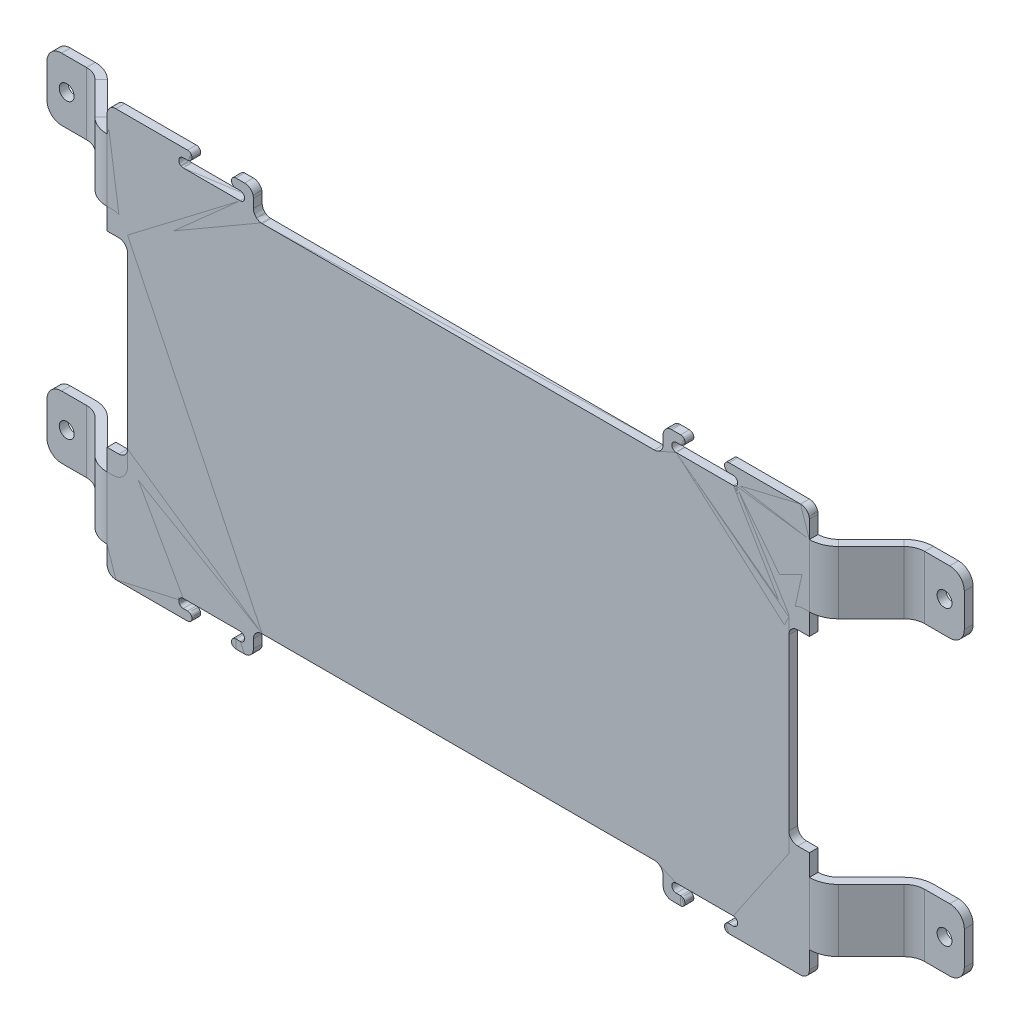
from build123d import *

# Parameters (mm, degrees)
SKETCH1_W               = 300
SKETCH1_H               = 121.403047612
BOSS_EXTRUDE1_DEPTH     = 3
SKETCH2_W               = 51.145988648
SKETCH2_H               = 64
CUT_EXTRUDE1_DEPTH      = 3
SKETCH3_W               = 50
SKETCH3_H               = 9
BOSS_EXTRUDE2_DEPTH     = 3
MIRROR4_COPY_1_SKETCH_W = 50
MIRROR4_COPY_1_SKETCH_H = 9
MIRROR4_COPY_1_DEPTH    = 3
FILLET2_R               = 3
FILLET3_R               = 3
SKETCH4_R               = 2.55
CUT_EXTRUDE2_DEPTH      = 3
SKETCH5_W               = 13.5
SKETCH5_H               = 3
CUT_EXTRUDE3_DEPTH      = 3
MIRROR6_COPY_1_SKETCH_W = 13.5
MIRROR6_COPY_1_SKETCH_H = 3
MIRROR6_COPY_1_DEPTH    = 3
FILLET4_R               = 1.5
SKETCH23_W              = 33.720108899
SKETCH23_H              = 36.264957758
SKETCH23_W_2            = 33.5
SKETCH23_H_2            = 38.701523806
SKETCH23_W_3            = 34.098271517
SKETCH23_H_3            = 33.701523806
SKETCH23_W_4            = 35
SKETCH23_H_4            = 37.201523806
CUT_EXTRUDE5_DEPTH      = 3
CONVERT_SOLID1_DEPTH    = 3
EDGE_FLANGE5_DEPTH      = 28.701523806
EDGE_FLANGE6_DEPTH      = 28.701523806
SKETCH34_R              = 2.55
CUT_EXTRUDE6_DEPTH      = 3
CUT_EXTRUDE7_START      = -3
SKETCH35_W              = 46.091883092
SKETCH35_H              = 10.3
CUT_EXTRUDE7_DEPTH      = 19.192388
SKETCH36_W              = 2.331883092
SKETCH36_H              = 21.401523806
CUT_EXTRUDE8_DEPTH      = 3
MIRROR8_COPY_1_DEPTH    = 28.701523806
MIRROR8_COPY_2_DEPTH    = 28.701523806
MIRROR8_COPY_3_SKETCH_R = 2.55
MIRROR8_COPY_3_DEPTH    = 3
MIRROR8_START           = -3
MIRROR8_COPY_4_SKETCH_W = 46.091883092
MIRROR8_COPY_4_SKETCH_H = 10.3
MIRROR8_COPY_4_DEPTH    = 19.192388
MIRROR8_COPY_5_SKETCH_W = 2.331883092
MIRROR8_COPY_5_SKETCH_H = 21.401523806
MIRROR8_COPY_5_DEPTH    = 3
FILLET5_R               = 5
FILLET6_R               = 5


# Read off the part's stored shape, not the designer's step: Convert-Solid1
# Sheet-metal steps are written as plain solids
with BuildPart() as part:
    # Sketch1 → Boss-Extrude1 (new body)
    with BuildSketch(Plane.XY):
        Rectangle(SKETCH1_W, SKETCH1_H)
    extrude(amount=BOSS_EXTRUDE1_DEPTH)

    # Sketch2 → Cut-Extrude1 (cut)
    with BuildSketch(Plane.XY.offset(3)):
        with Locations((-138.572994324, 0)):
            Rectangle(SKETCH2_W, SKETCH2_H)
    cut_extrude1 = extrude(amount=-CUT_EXTRUDE1_DEPTH, mode=Mode.SUBTRACT)

    # Mirror1: Cut-Extrude1 across plane
    add(cut_extrude1.mirror(Plane(origin=(0, 0, 0), x_dir=(0, 0, 1), z_dir=(1, 0, 0))), mode=Mode.SUBTRACT)

    # Sketch3 → Boss-Extrude2 (add)
    with BuildSketch(Plane.XY.offset(3)):
        with Locations((-95, -65.201523806)):
            Rectangle(SKETCH3_W, SKETCH3_H)
        with BuildLine():
            Line((-94, -63.701523806), (-74.5, -63.701523806))
            ThreePointArc((-74.5, -63.701523806), (-73, -65.201523806), (-74.5, -66.701523806))
            Line((-74.5, -66.701523806), (-94, -66.701523806))
            ThreePointArc((-94, -66.701523806), (-95.5, -65.201523806), (-94, -63.701523806))
        make_face(mode=Mode.SUBTRACT)
    boss_extrude2 = extrude(amount=-BOSS_EXTRUDE2_DEPTH)

    # Mirror3: Boss-Extrude2 across plane
    add(boss_extrude2.mirror(Plane.ZX))

    # Mirror4: Boss-Extrude2 across plane
    add(boss_extrude2.mirror(Plane(origin=(0, 0, 0), x_dir=(0, 0, 1), z_dir=(1, 0, 0))))

    # Mirror4 copy 1 sketch → Mirror4 copy 1 (add)
    with BuildSketch(Plane(origin=(0, 0, 3), x_dir=(-1, 0, 0), z_dir=(0, 0, 1))):
        with Locations((-95, -65.201523806)):
            Rectangle(MIRROR4_COPY_1_SKETCH_W, MIRROR4_COPY_1_SKETCH_H)
        with BuildLine():
            Line((-94, -63.701523806), (-74.5, -63.701523806))
            ThreePointArc((-74.5, -63.701523806), (-73, -65.201523806), (-74.5, -66.701523806))
            Line((-74.5, -66.701523806), (-94, -66.701523806))
            ThreePointArc((-94, -66.701523806), (-95.5, -65.201523806), (-94, -63.701523806))
        make_face(mode=Mode.SUBTRACT)
    extrude(amount=-MIRROR4_COPY_1_DEPTH)

    # Fillet2
    fillet2_edges = [part.edges().sort_by_distance(p)[0] for p in [
        (120, -60.701523806, 1.5),
        (120, 69.701523806, 1.5),
        (120, 60.701523806, 1.5),
        (70, 60.701523806, 1.5),
        (70, 69.701523806, 1.5),
        (-120, -69.701523806, 1.5),
        (-120, -60.701523806, 1.5),
        (-70, -60.701523806, 1.5),
        (-70, -69.701523806, 1.5),
        (-70, 60.701523806, 1.5),
        (-70, 69.701523806, 1.5),
        (-120, 69.701523806, 1.5),
        (-120, 60.701523806, 1.5),
        (70, -60.701523806, 1.5),
        (70, -69.701523806, 1.5),
        (120, -69.701523806, 1.5),
    ]]
    fillet(fillet2_edges, radius=FILLET2_R)

    # Fillet3
    fillet3_edges = [part.edges().sort_by_distance(p)[0] for p in [
        (-150, 32, 1.5),
        (-150, -32, 1.5),
        (-113, -32, 1.5),
        (-113, 32, 1.5),
        (113, 32, 1.5),
        (113, -32, 1.5),
        (150, 32, 1.5),
        (150, -32, 1.5),
        (-150, -60.701523806, 1.5),
        (150, -60.701523806, 1.5),
        (150, 60.701523806, 1.5),
        (-150, 60.701523806, 1.5),
    ]]
    fillet(fillet3_edges, radius=FILLET3_R)

    # Sketch4 → Cut-Extrude2 (cut)
    with BuildSketch(Plane(origin=(0, 0, 0), x_dir=(-1, 0, 0), z_dir=(0, 0, -1))):
        with Locations((-139.660923088, -50)):
            Circle(SKETCH4_R)
        with Locations((-139.660923088, 50)):
            Circle(SKETCH4_R)
        with Locations((150, -50)):
            Circle(SKETCH4_R)
        with Locations((150, 50)):
            Circle(SKETCH4_R)
    extrude(amount=-CUT_EXTRUDE2_DEPTH, mode=Mode.SUBTRACT)

    # Sketch5 → Cut-Extrude3 (cut)
    with BuildSketch(Plane.XY.offset(3)):
        with Locations((84.25, 68.201523806)):
            Rectangle(SKETCH5_W, SKETCH5_H)
    cut_extrude3 = extrude(amount=-CUT_EXTRUDE3_DEPTH, mode=Mode.SUBTRACT)

    # Mirror5: Cut-Extrude3 across plane
    add(cut_extrude3.mirror(Plane.ZX), mode=Mode.SUBTRACT)

    # Mirror6: Cut-Extrude3 across plane
    add(cut_extrude3.mirror(Plane(origin=(0, 0, 0), x_dir=(0, 0, 1), z_dir=(1, 0, 0))), mode=Mode.SUBTRACT)

    # Mirror6 copy 1 sketch → Mirror6 copy 1 (cut)
    with BuildSketch(Plane(origin=(0, 0, 3), x_dir=(-1, 0, 0), z_dir=(0, 0, 1))):
        with Locations((84.25, 68.201523806)):
            Rectangle(MIRROR6_COPY_1_SKETCH_W, MIRROR6_COPY_1_SKETCH_H)
    extrude(amount=-MIRROR6_COPY_1_DEPTH, mode=Mode.SUBTRACT)

    # Fillet4
    fillet4_edges = [part.edges().sort_by_distance(p)[0] for p in [
        (91, 66.701523806, 1.5),
        (77.5, 66.701523806, 1.5),
        (77.5, 69.701523806, 1.5),
        (91, 69.701523806, 1.5),
        (-91, 69.701523806, 1.5),
        (-91, 66.701523806, 1.5),
        (-77.5, 66.701523806, 1.5),
        (-77.5, 69.701523806, 1.5),
        (-77.5, -69.701523806, 1.5),
        (-77.5, -66.701523806, 1.5),
        (-91, -69.701523806, 1.5),
        (-91, -66.701523806, 1.5),
        (77.5, -69.701523806, 1.5),
        (91, -69.701523806, 1.5),
        (91, -66.701523806, 1.5),
        (77.5, -66.701523806, 1.5),
    ]]
    fillet(fillet4_edges, radius=FILLET4_R - 0.0001)  # a hair under: the kernel refuses the full size

    # Sketch23 → Cut-Extrude5 (cut)
    with BuildSketch(Plane.XY.offset(3)):
        with Locations((-136.86005445, 45.569044927)):
            Rectangle(SKETCH23_W, SKETCH23_H)
        with Locations((-136.75, -44.350761903)):
            Rectangle(SKETCH23_W_2, SKETCH23_H_2)
        with Locations((137.049135759, -46.850761903)):
            Rectangle(SKETCH23_W_3, SKETCH23_H_3)
        with Locations((137.5, 45.100761903)):
            Rectangle(SKETCH23_W_4, SKETCH23_H_4)
    extrude(amount=-CUT_EXTRUDE5_DEPTH, mode=Mode.SUBTRACT)


with BuildPart() as body_2:
    # Convert-Solid1 outline → Convert-Solid1 (new body)
    with BuildSketch(Plane.XY):
        with BuildLine():
            ThreePointArc((-120, -66.701523806), (-119.121320344, -68.822844149), (-117, -69.701523806))
            Line((-117, -69.701523806), (-92.5, -69.701523806))
            ThreePointArc((-92.5, -69.701523806), (-91.439339828, -69.262183978), (-91, -68.201523806))
            ThreePointArc((-91, -68.201523806), (-91.439339828, -67.140863634), (-92.5, -66.701523806))
            Line((-92.5, -66.701523806), (-94, -66.701523806))
            ThreePointArc((-94, -66.701523806), (-95.5, -65.201523806), (-94, -63.701523806))
            Line((-94, -63.701523806), (-74.5, -63.701523806))
            ThreePointArc((-74.5, -63.701523806), (-73, -65.201523806), (-74.5, -66.701523806))
            Line((-74.5, -66.701523806), (-76, -66.701523806))
            ThreePointArc((-76, -66.701523806), (-77.060660172, -67.140863634), (-77.5, -68.201523806))
            ThreePointArc((-77.5, -68.201523806), (-77.060660172, -69.262183978), (-76, -69.701523806))
            Line((-76, -69.701523806), (-73, -69.701523806))
            ThreePointArc((-73, -69.701523806), (-70.878679656, -68.822844149), (-70, -66.701523806))
            Line((-70, -66.701523806), (-70, -63.701523806))
            ThreePointArc((-70, -63.701523806), (-69.121320344, -61.580203462), (-67, -60.701523806))
            Line((-67, -60.701523806), (67, -60.701523806))
            ThreePointArc((67, -60.701523806), (69.121320344, -61.580203462), (70, -63.701523806))
            Line((70, -63.701523806), (70, -66.701523806))
            ThreePointArc((70, -66.701523806), (70.878679656, -68.822844149), (73, -69.701523806))
            Line((73, -69.701523806), (76, -69.701523806))
            ThreePointArc((76, -69.701523806), (77.060660172, -69.262183978), (77.5, -68.201523806))
            ThreePointArc((77.5, -68.201523806), (77.060660172, -67.140863634), (76, -66.701523806))
            Line((76, -66.701523806), (74.5, -66.701523806))
            ThreePointArc((74.5, -66.701523806), (73, -65.201523806), (74.5, -63.701523806))
            Line((74.5, -63.701523806), (94, -63.701523806))
            ThreePointArc((94, -63.701523806), (95.5, -65.201523806), (94, -66.701523806))
            Line((94, -66.701523806), (92.5, -66.701523806))
            ThreePointArc((92.5, -66.701523806), (91.439339828, -67.140863634), (91, -68.201523806))
            ThreePointArc((91, -68.201523806), (91.439339828, -69.262183978), (92.5, -69.701523806))
            Line((92.5, -69.701523806), (117, -69.701523806))
            ThreePointArc((117, -69.701523806), (119.121320344, -68.822844149), (120, -66.701523806))
            Line((120, -66.701523806), (120, -32))
            Line((120, -32), (116, -32))
            ThreePointArc((116, -32), (113.878679656, -31.121320344), (113, -29))
            Line((113, -29), (113, 29))
            ThreePointArc((113, 29), (113.878679656, 31.121320344), (116, 32))
            Line((116, 32), (120, 32))
            Line((120, 32), (120, 66.701523806))
            ThreePointArc((120, 66.701523806), (119.121320344, 68.822844149), (117, 69.701523806))
            Line((117, 69.701523806), (92.5, 69.701523806))
            ThreePointArc((92.5, 69.701523806), (91.439339828, 69.262183978), (91, 68.201523806))
            ThreePointArc((91, 68.201523806), (91.439339828, 67.140863634), (92.5, 66.701523806))
            Line((92.5, 66.701523806), (94, 66.701523806))
            ThreePointArc((94, 66.701523806), (95.5, 65.201523806), (94, 63.701523806))
            Line((94, 63.701523806), (74.5, 63.701523806))
            ThreePointArc((74.5, 63.701523806), (73, 65.201523806), (74.5, 66.701523806))
            Line((74.5, 66.701523806), (76, 66.701523806))
            ThreePointArc((76, 66.701523806), (77.060660172, 67.140863634), (77.5, 68.201523806))
            ThreePointArc((77.5, 68.201523806), (77.060660172, 69.262183978), (76, 69.701523806))
            Line((76, 69.701523806), (73, 69.701523806))
            ThreePointArc((73, 69.701523806), (70.878679656, 68.822844149), (70, 66.701523806))
            Line((70, 66.701523806), (70, 63.701523806))
            ThreePointArc((70, 63.701523806), (69.121320344, 61.580203462), (67, 60.701523806))
            Line((67, 60.701523806), (-67, 60.701523806))
            ThreePointArc((-67, 60.701523806), (-69.121320344, 61.580203462), (-70, 63.701523806))
            Line((-70, 63.701523806), (-70, 66.701523806))
            ThreePointArc((-70, 66.701523806), (-70.878679656, 68.822844149), (-73, 69.701523806))
            Line((-73, 69.701523806), (-76, 69.701523806))
            ThreePointArc((-76, 69.701523806), (-77.060660172, 69.262183978), (-77.5, 68.201523806))
            ThreePointArc((-77.5, 68.201523806), (-77.060660172, 67.140863634), (-76, 66.701523806))
            Line((-76, 66.701523806), (-74.5, 66.701523806))
            ThreePointArc((-74.5, 66.701523806), (-73, 65.201523806), (-74.5, 63.701523806))
            Line((-74.5, 63.701523806), (-94, 63.701523806))
            ThreePointArc((-94, 63.701523806), (-95.5, 65.201523806), (-94, 66.701523806))
            Line((-94, 66.701523806), (-92.5, 66.701523806))
            ThreePointArc((-92.5, 66.701523806), (-91.439339828, 67.140863634), (-91, 68.201523806))
            ThreePointArc((-91, 68.201523806), (-91.439339828, 69.262183978), (-92.5, 69.701523806))
            Line((-92.5, 69.701523806), (-117, 69.701523806))
            ThreePointArc((-117, 69.701523806), (-119.121320344, 68.822844149), (-120, 66.701523806))
            Line((-120, 66.701523806), (-120, 32))
            Line((-120, 32), (-116, 32))
            ThreePointArc((-116, 32), (-113.878679656, 31.121320344), (-113, 29))
            Line((-113, 29), (-113, -29))
            ThreePointArc((-113, -29), (-113.878679656, -31.121320344), (-116, -32))
            Line((-116, -32), (-120, -32))
            Line((-120, -32), (-120, -66.701523806))
        make_face()
    extrude(amount=CONVERT_SOLID1_DEPTH)

    # Edge-Flange5 section (across the edge) → Edge-Flange5 (add)
    with BuildSketch(Plane(origin=(122.899494937, -32, 0), x_dir=(-0.7071067811865438, 0, -0.7071067811865512), z_dir=(0, -1, 0))):
        with BuildLine():
            Line((-3, 2.899494937), (-3, 18.757359313))
            Line((-3, 18.757359313), (0, 18.757359313))
            Line((0, 18.757359313), (0, 2.899494937))
            ThreePointArc((0, 2.899494937), (0.532843272, 0.22071091), (2.050252532, -2.050252532))
            Line((2.050252532, -2.050252532), (-0.071067812, -4.171572875))
            ThreePointArc((-0.071067812, -4.171572875), (-2.238795325, -0.927339387), (-3, 2.899494937))
        make_face()
    edge_flange5 = extrude(amount=EDGE_FLANGE5_DEPTH)

    # Edge-Flange6 section (across the edge) → Edge-Flange6 (add)
    with BuildSketch(Plane(origin=(140.334523779, -60.701523806, -13.192388155), x_dir=(0, 0, 1), z_dir=(0, 1, 0))):
        with BuildLine():
            Line((-3, 2.899494937), (-3, 18.757359313))
            Line((-3, 18.757359313), (0, 18.757359313))
            Line((0, 18.757359313), (0, 2.899494937))
            ThreePointArc((0, 2.899494937), (0.532843272, 0.22071091), (2.050252532, -2.050252532))
            Line((2.050252532, -2.050252532), (-0.071067812, -4.171572875))
            ThreePointArc((-0.071067812, -4.171572875), (-2.238795325, -0.927339387), (-3, 2.899494937))
        make_face()
    edge_flange6 = extrude(amount=EDGE_FLANGE6_DEPTH)

    # Sketch34 → Cut-Extrude6 (cut)
    with BuildSketch(Plane.XY.offset(-13.192388155)):
        with Locations((150, -50)):
            Circle(SKETCH34_R)
    cut_extrude6 = extrude(amount=-CUT_EXTRUDE6_DEPTH, mode=Mode.SUBTRACT)

    # Sketch35 → Cut-Extrude7 (cut)
    with BuildSketch(Plane.XY.offset(-13.192388155).offset(CUT_EXTRUDE7_START)):
        with Locations((136.045941546, -34.15)):
            Rectangle(SKETCH35_W, SKETCH35_H)
    cut_extrude7 = extrude(amount=CUT_EXTRUDE7_DEPTH, mode=Mode.SUBTRACT)

    # Sketch36 → Cut-Extrude8 (cut)
    with BuildSketch(Plane.XY.offset(-13.192388155)):
        with Locations((157.925941546, -50.000761903)):
            Rectangle(SKETCH36_W, SKETCH36_H)
    cut_extrude8 = extrude(amount=-CUT_EXTRUDE8_DEPTH, mode=Mode.SUBTRACT)

    # Mirror7: Edge-Flange5, Edge-Flange6 across plane
    add(edge_flange5.mirror(Plane.ZX))
    add(edge_flange6.mirror(Plane.ZX))

    # Mirror7 2: Cut-Extrude6, Cut-Extrude7, Cut-Extrude8 across plane
    add(cut_extrude6.mirror(Plane.ZX), mode=Mode.SUBTRACT)
    add(cut_extrude7.mirror(Plane.ZX), mode=Mode.SUBTRACT)
    add(cut_extrude8.mirror(Plane.ZX), mode=Mode.SUBTRACT)

    # Mirror8: Edge-Flange5, Edge-Flange6, Cut-Extrude6, Cut-Extrude7, Cut-Extrude8 across plane
    add(edge_flange5.mirror(Plane(origin=(0, 0, 0), x_dir=(0, 0, 1), z_dir=(1, 0, 0))))
    add(edge_flange6.mirror(Plane(origin=(0, 0, 0), x_dir=(0, 0, 1), z_dir=(1, 0, 0))))
    add(cut_extrude6.mirror(Plane(origin=(0, 0, 0), x_dir=(0, 0, 1), z_dir=(1, 0, 0))), mode=Mode.SUBTRACT)
    add(cut_extrude7.mirror(Plane(origin=(0, 0, 0), x_dir=(0, 0, 1), z_dir=(1, 0, 0))), mode=Mode.SUBTRACT)
    add(cut_extrude8.mirror(Plane(origin=(0, 0, 0), x_dir=(0, 0, 1), z_dir=(1, 0, 0))), mode=Mode.SUBTRACT)

    # Mirror8 copy 1 sketch → Mirror8 copy 1 (add)
    with BuildSketch(Plane(origin=(-122.899494937, 32, 0), x_dir=(0.7071067811865438, 0, -0.7071067811865512), z_dir=(0, 1, 0))):
        with BuildLine():
            Line((-3, 2.899494937), (-3, 18.757359313))
            Line((-3, 18.757359313), (0, 18.757359313))
            Line((0, 18.757359313), (0, 2.899494937))
            ThreePointArc((0, 2.899494937), (0.532843272, 0.22071091), (2.050252532, -2.050252532))
            Line((2.050252532, -2.050252532), (-0.071067812, -4.171572875))
            ThreePointArc((-0.071067812, -4.171572875), (-2.238795325, -0.927339387), (-3, 2.899494937))
        make_face()
    extrude(amount=MIRROR8_COPY_1_DEPTH)

    # Mirror8 copy 2 sketch → Mirror8 copy 2 (add)
    with BuildSketch(Plane(origin=(-140.334523779, 60.701523806, -13.192388155), x_dir=(0, 0, 1), z_dir=(0, -1, 0))):
        with BuildLine():
            Line((-3, 2.899494937), (-3, 18.757359313))
            Line((-3, 18.757359313), (0, 18.757359313))
            Line((0, 18.757359313), (0, 2.899494937))
            ThreePointArc((0, 2.899494937), (0.532843272, 0.22071091), (2.050252532, -2.050252532))
            Line((2.050252532, -2.050252532), (-0.071067812, -4.171572875))
            ThreePointArc((-0.071067812, -4.171572875), (-2.238795325, -0.927339387), (-3, 2.899494937))
        make_face()
    extrude(amount=MIRROR8_COPY_2_DEPTH)

    # Mirror8 copy 3 sketch → Mirror8 copy 3 (cut)
    with BuildSketch(Plane(origin=(0, 0, -13.192388155), x_dir=(-1, 0, 0), z_dir=(0, 0, 1))):
        with Locations((150, -50)):
            Circle(MIRROR8_COPY_3_SKETCH_R)
    extrude(amount=-MIRROR8_COPY_3_DEPTH, mode=Mode.SUBTRACT)

    # Mirror8 copy 4 sketch → Mirror8 copy 4 (cut)
    with BuildSketch(Plane(origin=(0, 0, -13.192388155), x_dir=(-1, 0, 0), z_dir=(0, 0, 1)).offset(MIRROR8_START)):
        with Locations((136.045941546, -34.15)):
            Rectangle(MIRROR8_COPY_4_SKETCH_W, MIRROR8_COPY_4_SKETCH_H)
    extrude(amount=MIRROR8_COPY_4_DEPTH, mode=Mode.SUBTRACT)

    # Mirror8 copy 5 sketch → Mirror8 copy 5 (cut)
    with BuildSketch(Plane(origin=(0, 0, -13.192388155), x_dir=(-1, 0, 0), z_dir=(0, 0, 1))):
        with Locations((157.925941546, -50.000761903)):
            Rectangle(MIRROR8_COPY_5_SKETCH_W, MIRROR8_COPY_5_SKETCH_H)
    extrude(amount=-MIRROR8_COPY_5_DEPTH, mode=Mode.SUBTRACT)

    # Fillet5
    fillet5_edges = [body_2.edges().sort_by_distance(p)[0] for p in [
        (156.76, -60.701523806, -14.692388155),
        (156.76, -39.3, -14.692388155),
        (156.76, 60.701523806, -14.692388155),
        (156.76, 39.3, -14.692388155),
        (-156.76, -60.701523806, -14.692388155),
        (-156.76, -39.3, -14.692388155),
        (-156.76, 60.701523806, -14.692388155),
        (-156.76, 39.3, -14.692388155),
    ]]
    fillet(fillet5_edges, radius=FILLET5_R)

    # Fillet6
    fillet6_edges = [body_2.edges().sort_by_distance(p)[0] for p in [
        (113, -39.3, 1.499999922),
        (113, 39.3, 1.499999922),
        (-113, -39.3, 1.499999922),
        (-113, 39.3, 1.499999922),
    ]]
    fillet(fillet6_edges, radius=FILLET6_R)


solid = Compound([part.part, body_2.part])
